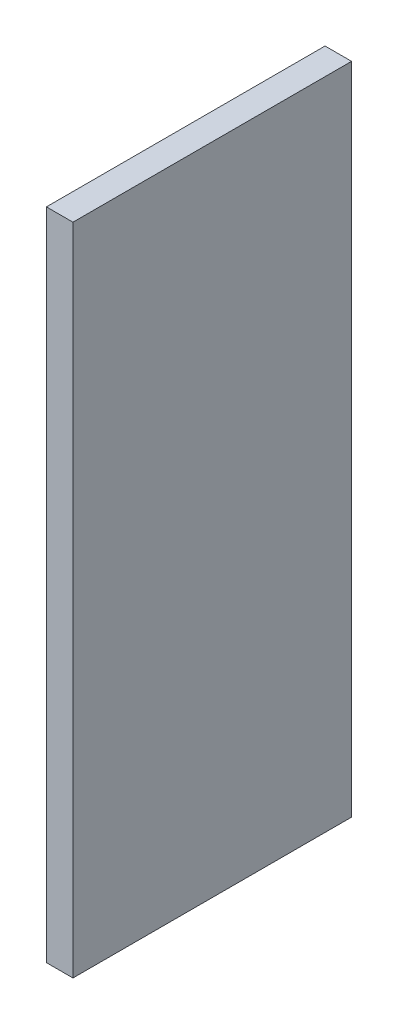
from build123d import *

# Parameters (mm, degrees)
SKETCH_1_W      = 3
SKETCH_1_H      = 74
EXTRUDE_1_DEPTH = 31.5


with BuildPart() as part:
    # Эскиз1 → Бобышка-Вытянуть1 (new body)
    with BuildSketch(Plane.XY):
        with Locations((1.5, 37)):
            Rectangle(SKETCH_1_W, SKETCH_1_H)
    extrude(amount=EXTRUDE_1_DEPTH)


solid = part.part
